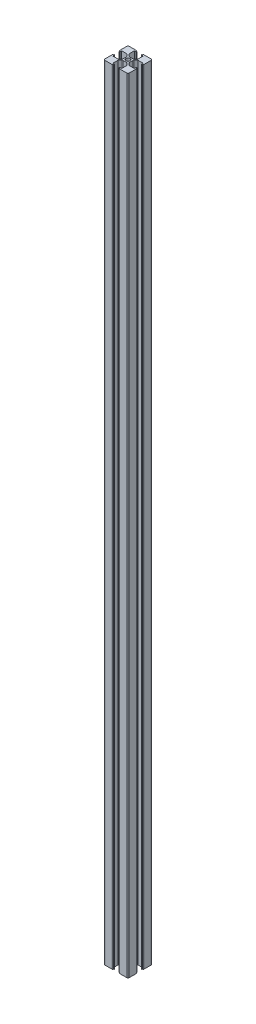
from build123d import *

# Parameters (mm, degrees)
BOSS_EXTRUDE1_DEPTH = 965.2
FILLET1_R           = 0.35


with BuildPart() as part:
    # Sketch1 → Boss-Extrude1 (new body)
    with BuildSketch(Plane(origin=(0, 0, 0), x_dir=(1, 0, 0), z_dir=(0, 1, 0))):
        with BuildLine():
            Line((5.5, 6.560660172), (3.425126266, 4.485786438))
            ThreePointArc((3.425126266, 4.485786438), (2.776279568, 4.052240935), (2.010912703, 3.9))
            Line((2.010912703, 3.9), (0, 3.9))
            Line((0, 3.899999921), (-2.010912625, 3.899999921))
            ThreePointArc((-2.010912625, 3.899999921), (-2.77627949, 4.052240856), (-3.425126187, 4.485786359))
            Line((-3.425126187, 4.485786359), (-5.5, 6.560660172))
            Line((-5.5, 6.560660172), (-5.5, 13.2))
            Line((-5.5, 13.2), (-3.1, 13.2))
            Line((-3.1, 13.2), (-3.1, 14.24))
            Line((-3.1, 14.24), (-4.1, 14.24))
            Line((-4.1, 14.24), (-4.1, 15))
            Line((-4.1, 15), (-13.5, 15))
            ThreePointArc((-13.5, 15), (-14.560660172, 14.560660172), (-15, 13.5))
            Line((-15, 13.5), (-15, 4.1))
            Line((-15, 4.1), (-14.24, 4.1))
            Line((-14.24, 4.1), (-14.24, 3.1))
            Line((-14.24, 3.1), (-13.2, 3.1))
            Line((-13.2, 3.1), (-13.2, 5.5))
            Line((-13.2, 5.5), (-6.560660172, 5.5))
            Line((-6.560660172, 5.5), (-4.485786438, 3.425126266))
            ThreePointArc((-4.485786438, 3.425126266), (-4.052240935, 2.776279568), (-3.9, 2.010912703))
            Line((-3.9, 2.010912703), (-3.9, 0))
            Line((-3.899999921, 0), (-3.899999921, -2.010912625))
            ThreePointArc((-3.899999921, -2.010912625), (-4.052240856, -2.77627949), (-4.485786359, -3.425126187))
            Line((-4.485786359, -3.425126187), (-6.560660172, -5.5))
            Line((-6.560660172, -5.5), (-13.2, -5.5))
            Line((-13.2, -5.5), (-13.2, -3.1))
            Line((-13.2, -3.1), (-14.24, -3.1))
            Line((-14.24, -3.1), (-14.24, -4.1))
            Line((-14.24, -4.1), (-15, -4.1))
            Line((-15, -4.1), (-15, -13.5))
            ThreePointArc((-15, -13.5), (-14.560660172, -14.560660172), (-13.5, -15))
            Line((-13.5, -15), (-4.1, -15))
            Line((-4.1, -15), (-4.1, -14.24))
            Line((-4.1, -14.24), (-3.1, -14.24))
            Line((-3.1, -14.24), (-3.1, -13.2))
            Line((-3.1, -13.2), (-5.5, -13.2))
            Line((-5.5, -13.2), (-5.5, -6.560660172))
            Line((-5.5, -6.560660172), (-3.425126266, -4.485786438))
            ThreePointArc((-3.425126266, -4.485786438), (-2.776279568, -4.052240935), (-2.010912703, -3.9))
            Line((-2.010912703, -3.9), (0, -3.9))
            Line((0, -3.899999921), (2.010912625, -3.899999921))
            ThreePointArc((2.010912625, -3.899999921), (2.77627949, -4.052240856), (3.425126187, -4.485786359))
            Line((3.425126187, -4.485786359), (5.5, -6.560660172))
            Line((5.5, -6.560660172), (5.5, -13.2))
            Line((5.5, -13.2), (3.1, -13.2))
            Line((3.1, -13.2), (3.1, -14.24))
            Line((3.1, -14.24), (4.1, -14.24))
            Line((4.1, -14.24), (4.1, -15))
            Line((4.1, -15), (13.5, -15))
            ThreePointArc((13.5, -15), (14.560660172, -14.560660172), (15, -13.5))
            Line((15, -13.5), (15, -4.1))
            Line((15, -4.1), (14.24, -4.1))
            Line((14.24, -4.1), (14.24, -3.1))
            Line((14.24, -3.1), (13.2, -3.1))
            Line((13.2, -3.1), (13.2, -5.5))
            Line((13.2, -5.5), (6.560660172, -5.5))
            Line((6.560660172, -5.5), (4.485786438, -3.425126266))
            ThreePointArc((4.485786438, -3.425126266), (4.052240935, -2.776279568), (3.9, -2.010912703))
            Line((3.9, -2.010912703), (3.9, 0))
            Line((3.899999921, 0), (3.899999921, 2.010912625))
            ThreePointArc((3.899999921, 2.010912625), (4.052240856, 2.77627949), (4.485786359, 3.425126187))
            Line((4.485786359, 3.425126187), (6.560660172, 5.5))
            Line((6.560660172, 5.5), (13.2, 5.5))
            Line((13.2, 5.5), (13.2, 3.1))
            Line((13.2, 3.1), (14.24, 3.1))
            Line((14.24, 3.1), (14.24, 4.1))
            Line((14.24, 4.1), (15, 4.1))
            Line((15, 4.1), (15, 13.5))
            ThreePointArc((15, 13.5), (14.560660172, 14.560660172), (13.5, 15))
            Line((13.5, 15), (4.1, 15))
            Line((4.1, 15), (4.1, 14.24))
            Line((4.1, 14.24), (3.1, 14.24))
            Line((3.1, 14.24), (3.1, 13.2))
            Line((3.1, 13.2), (5.5, 13.2))
            Line((5.5, 13.2), (5.5, 6.560660172))
        make_face()
        with BuildLine():
            ThreePointArc((0, 2.5), (1.767766953, 1.767766953), (2.5, 0))
            ThreePointArc((2.5, 0), (1.767766953, -1.767766953), (0, -2.5))
            ThreePointArc((0, -2.5), (-1.767766953, -1.767766953), (-2.5, 0))
            ThreePointArc((-2.5, 0), (-1.767766953, 1.767766953), (0, 2.5))
        make_face(mode=Mode.SUBTRACT)
    extrude(amount=BOSS_EXTRUDE1_DEPTH)

    # Fillet1
    fillet1_edges = [part.edges().sort_by_distance(p)[0] for p in [
        (-4.1, 482.6, -15),
        (-4.1, 482.6, -14.24),
        (-3.1, 482.6, -14.24),
        (-3.1, 482.6, -13.2),
        (-14.24, 482.6, -4.1),
        (-15, 482.6, -4.1),
        (-14.24, 482.6, -3.1),
        (-13.2, 482.6, -3.1),
        (-15, 482.6, 4.1),
        (-14.24, 482.6, 4.1),
        (-14.24, 482.6, 3.1),
        (-13.2, 482.6, 3.1),
        (-4.1, 482.6, 15),
        (-4.1, 482.6, 14.24),
        (-3.1, 482.6, 14.24),
        (-3.1, 482.6, 13.2),
        (4.1, 482.6, 15),
        (4.1, 482.6, 14.24),
        (3.1, 482.6, 14.24),
        (3.1, 482.6, 13.2),
        (15, 482.6, 4.1),
        (14.24, 482.6, 4.1),
        (14.24, 482.6, 3.1),
        (13.2, 482.6, 3.1),
        (15, 482.6, -4.1),
        (14.24, 482.6, -4.1),
        (14.24, 482.6, -3.1),
        (13.2, 482.6, -3.1),
        (3.1, 482.6, -13.2),
        (4.1, 482.6, -15),
        (5.5, 482.6, -6.560660172),
        (3.1, 482.6, -14.24),
        (4.1, 482.6, -14.24),
    ]]
    fillet(fillet1_edges, radius=FILLET1_R)


solid = part.part
